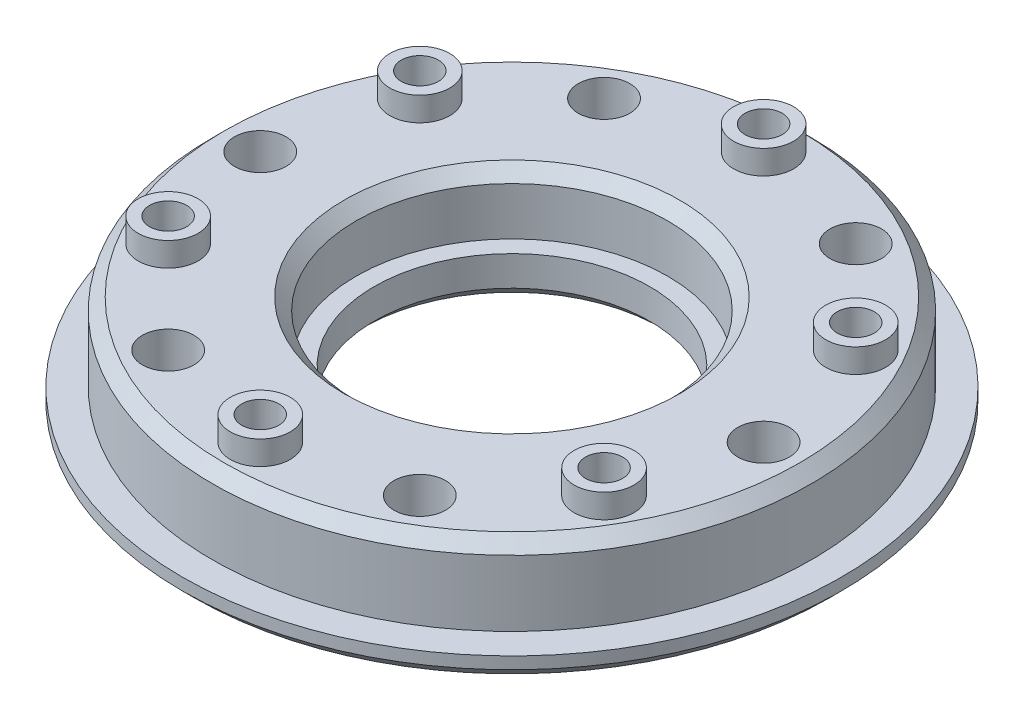
from build123d import *
from build123d.topology import SkipClean

# Parameters (mm, degrees)
SKETCH1_R                    = 27.5
BOSS_EXTRUDE1_DEPTH          = 2
SKETCH2_R                    = 25
BOSS_EXTRUDE2_DEPTH          = 6.5
SKETCH3_R                    = 13
CUT_EXTRUDE1_DEPTH           = 5
SKETCH4_R                    = 11.5
CUT_EXTRUDE2_DEPTH           = 8.5
CHAMFER1_SIZE                = 1
SKETCH5_R                    = 1.55
CUT_EXTRUDE3_DEPTH           = 8.5
SKETCH6_R                    = 3
CUT_EXTRUDE4_DEPTH           = 6
CHAMFER2_SIZE                = 1
CIRPATTERN1_COUNT            = 6
CHAMFER2_OF_CIRPATTERN1_SIZE = 1
SKETCH7_R                    = 1.55
CUT_EXTRUDE5_DEPTH           = 8.5
SKETCH8_R                    = 2.15
CUT_EXTRUDE6_DEPTH           = 4.5
CIRPATTERN2_COUNT            = 6
SKETCH9_R                    = 2.5
SKETCH9_R_2                  = 1.55
BOSS_EXTRUDE3_DEPTH          = 2
CIRPATTERN3_COUNT            = 6


with BuildPart() as part:
    # Sketch1 → Boss-Extrude1 (new body)
    with BuildSketch(Plane(origin=(0, 0, 0), x_dir=(1, 0, 0), z_dir=(0, 1, 0))):
        with Locations(Location((0, 0, 0), (0, 0, 270))):
            Circle(SKETCH1_R)
    extrude(amount=BOSS_EXTRUDE1_DEPTH)

    # Sketch2 → Boss-Extrude2 (add)
    with BuildSketch(Plane(origin=(0, 2, 0), x_dir=(1, 0, 0), z_dir=(0, 1, 0))):
        with Locations(Location((0, 0, 0), (0, 0, 90))):
            Circle(SKETCH2_R)
    extrude(amount=BOSS_EXTRUDE2_DEPTH)

    # Sketch3 → Cut-Extrude1 (cut)
    with BuildSketch(Plane(origin=(0, 8.5, 0), x_dir=(1, 0, 0), z_dir=(0, 1, 0))):
        with Locations(Location((0, 0, 0), (0, 0, 270))):
            Circle(SKETCH3_R)
    extrude(amount=-CUT_EXTRUDE1_DEPTH, mode=Mode.SUBTRACT)

    # Sketch4 → Cut-Extrude2 (cut)
    with BuildSketch(Plane(origin=(0, 8.5, 0), x_dir=(1, 0, 0), z_dir=(0, 1, 0))):
        with Locations(Location((0, 0, 0), (0, 0, 270))):
            Circle(SKETCH4_R)
    extrude(amount=-CUT_EXTRUDE2_DEPTH, mode=Mode.SUBTRACT)

    # Chamfer1
    chamfer1_edges = [part.edges().sort_by_distance(p)[0] for p in [
        (0, 8.5, -13),
        (0, 0, -11.5),
        (0, 0, -27.5),
        (0, 8.5, 25),
    ]]
    chamfer(chamfer1_edges, length=CHAMFER1_SIZE)

    # Sketch5 → Cut-Extrude3 (cut)
    with BuildSketch(Plane.XZ):
        with Locations(Location((0, 21, 0), (0, 0, 270))):
            Circle(SKETCH5_R)
    cut_extrude3 = extrude(amount=-CUT_EXTRUDE3_DEPTH, mode=Mode.SUBTRACT)

    # Sketch6 → Cut-Extrude4 (cut)
    with BuildSketch(Plane.XZ):
        with Locations(Location((0, 21, 0), (0, 0, 270))):
            Circle(SKETCH6_R)
    cut_extrude4 = extrude(amount=-CUT_EXTRUDE4_DEPTH, mode=Mode.SUBTRACT)

    # Chamfer2
    chamfer2_edges = [part.edges().sort_by_distance(p)[0] for p in [
        (0, 0, 24),
    ]]
    chamfer(chamfer2_edges, length=CHAMFER2_SIZE)

    # CirPattern1: Cut-Extrude3, Cut-Extrude4 ×6 about axis
    cirpattern1_axis = Axis((0, 0, 0), (0, 1, 0))
    add([cut_extrude3.rotate(cirpattern1_axis, i * 360 / CIRPATTERN1_COUNT) for i in range(1, CIRPATTERN1_COUNT)], mode=Mode.SUBTRACT)
    add([cut_extrude4.rotate(cirpattern1_axis, i * 360 / CIRPATTERN1_COUNT) for i in range(1, CIRPATTERN1_COUNT)], mode=Mode.SUBTRACT)

    # Chamfer2 of CirPattern1
    chamfer2_of_cirpattern1_edges = [part.edges().sort_by_distance(p)[0] for p in [
        (20.784609691, 0, 12),
        (20.784609691, 0, -12),
        (0, 0, -24),
        (-20.784609691, 0, -12),
        (-20.784609691, 0, 12),
    ]]
    chamfer(chamfer2_of_cirpattern1_edges, length=CHAMFER2_OF_CIRPATTERN1_SIZE)

    # Sketch7 → Cut-Extrude5 (cut)
    with BuildSketch(Plane(origin=(0, 8.5, 0), x_dir=(1, 0, 0), z_dir=(0, 1, 0))):
        with Locations(Location((-10.5, 18.186533479, 0), (0, 0, 270))):
            Circle(SKETCH7_R)
    cut_extrude5 = extrude(amount=-CUT_EXTRUDE5_DEPTH, mode=Mode.SUBTRACT)

    # Sketch8 → Cut-Extrude6 (cut)
    with BuildSketch(Plane(origin=(0, 8.5, 0), x_dir=(1, 0, 0), z_dir=(0, 1, 0))):
        with Locations(Location((-10.5, 18.186533479, 0), (0, 0, 270))):
            Circle(SKETCH8_R)
    cut_extrude6 = extrude(amount=-CUT_EXTRUDE6_DEPTH, mode=Mode.SUBTRACT)

    # CirPattern2: Cut-Extrude5, Cut-Extrude6 ×6 about axis
    cirpattern2_axis = Axis((0, 0, 0), (0, 1, 0))
    add([cut_extrude5.rotate(cirpattern2_axis, i * 360 / CIRPATTERN2_COUNT) for i in range(1, CIRPATTERN2_COUNT)], mode=Mode.SUBTRACT)
    add([cut_extrude6.rotate(cirpattern2_axis, i * 360 / CIRPATTERN2_COUNT) for i in range(1, CIRPATTERN2_COUNT)], mode=Mode.SUBTRACT)

    # Sketch9 → Boss-Extrude3 (add)
    with SkipClean():  # the faces are left unmerged after this step: merging them gives an invalid solid
        with BuildSketch(Plane(origin=(0, 8.5, 0), x_dir=(1, 0, 0), z_dir=(0, 1, 0))):
            with Locations(Location((0, 21, 0), (0, 0, 270))):
                Circle(SKETCH9_R)
            with Locations(Location((0, 21, 0), (0, 0, 90))):
                Circle(SKETCH9_R_2, mode=Mode.SUBTRACT)
        boss_extrude3 = extrude(amount=BOSS_EXTRUDE3_DEPTH)
    add(part.part.scale(1), mode=Mode.REPLACE)  # the faces are merged on a copy

    # CirPattern3: Boss-Extrude3 ×6 about axis
    cirpattern3_axis = Axis((0, 0, 0), (0, 1, 0))
    for i in range(1, CIRPATTERN3_COUNT):
        add(boss_extrude3.rotate(cirpattern3_axis, i * 360 / CIRPATTERN3_COUNT))


solid = part.part
